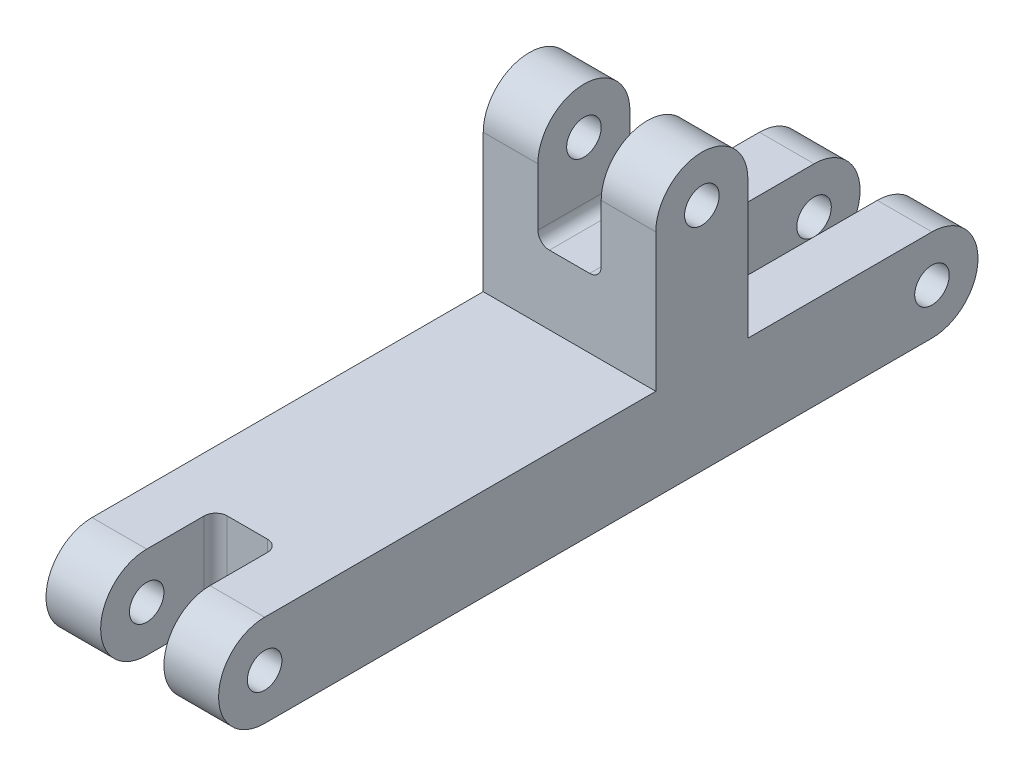
from build123d import *

# Parameters (mm, degrees)
CROQUIS1_R              = 1.5
SALIENTE_EXTRUIR1_DEPTH = 7.5
CROQUIS2_W              = 8
CROQUIS2_H              = 10
CROQUIS2_W_2            = 16
CROQUIS2_H_2            = 8
CROQUIS2_W_3            = 10
CORTAR_EXTRUIR1_DEPTH   = 2.75
REDONDEO1_R             = 1


with BuildPart() as part:
    # Croquis1 → Saliente-Extruir1 (new, symmetric)
    with BuildSketch(Plane(origin=(0, 0, 0), x_dir=(0, 0, -1), z_dir=(1, 0, 0))):
        with BuildLine():
            Line((-8, -4), (8, -4))
            ThreePointArc((8, -4), (12, 0), (8, 4))
            Line((8, 4), (-8, 4))
            Line((-8, 4), (-8, 16))
            ThreePointArc((-8, 16), (-12, 20), (-16, 16))
            Line((-16, 16), (-16, 4))
            Line((-16, 4), (-50, 4))
            ThreePointArc((-50, 4), (-54, 0), (-50, -4))
            Line((-50, -4), (-8, -4))
        make_face()
        with Locations((8, 0)):
            Circle(CROQUIS1_R, mode=Mode.SUBTRACT)
        with Locations((-12, 16)):
            Circle(CROQUIS1_R, mode=Mode.SUBTRACT)
        with Locations((-50, 0)):
            Circle(CROQUIS1_R, mode=Mode.SUBTRACT)
    extrude(amount=SALIENTE_EXTRUIR1_DEPTH, both=True)

    # Croquis2 → Cortar-Extruir1 (cut, symmetric)
    with BuildSketch(Plane(origin=(0, 0, 0), x_dir=(0, 0, -1), z_dir=(1, 0, 0))):
        with Locations((-12, 15)):
            Rectangle(CROQUIS2_W, CROQUIS2_H)
        with Locations((4, 0)):
            Rectangle(CROQUIS2_W_2, CROQUIS2_H_2)
        with Locations((-49, 0)):
            Rectangle(CROQUIS2_W_3, CROQUIS2_H_2)
    extrude(amount=CORTAR_EXTRUIR1_DEPTH, both=True, mode=Mode.SUBTRACT)

    # Redondeo1
    redondeo1_edges = [part.edges().sort_by_distance(p)[0] for p in [
        (2.75, 0, 44),
        (-2.75, 0, 44),
        (2.75, 0, 4),
        (-2.75, 0, 4),
        (2.75, 10, 12),
        (-2.75, 10, 12),
    ]]
    fillet(redondeo1_edges, radius=REDONDEO1_R)


solid = part.part
